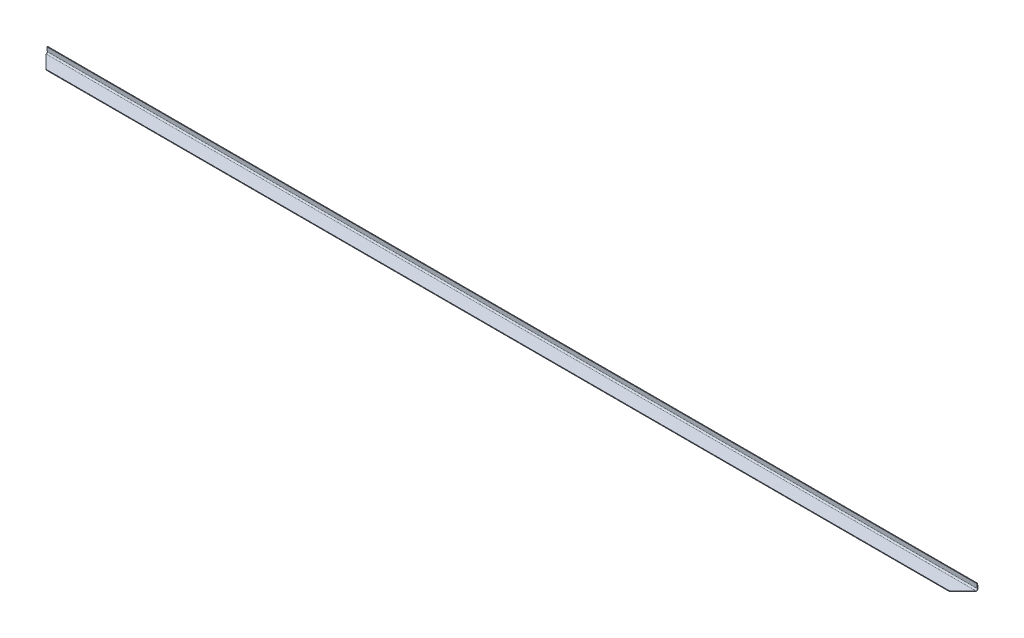
from build123d import *

# Parameters (mm, degrees)
EXTRUDE_1_DEPTH        = 1
SM_EDGE_FLANGE_1_DEPTH = 1410


# Sheet-metal steps are written as plain solids
with BuildPart() as part:
    # Sketch 1 → Бобышка-Вытянуть1 (new body)
    with BuildSketch(Plane(origin=(0, 0, 0), x_dir=(1, 0, 0), z_dir=(0, 1, 0))):
        Polygon((0, 0), (20, -20), (1390, -20), (1410, 0), align=None)
    extrude(amount=EXTRUDE_1_DEPTH)

    # Ребро-кромка1 section (across the edge) → Ребро-кромка1 (add)
    with BuildSketch(Plane(origin=(1410, 1, -2.182617002), x_dir=(0, -0.08715574274765482, 0.9961946980917459), z_dir=(-1, 0, 0))):
        with BuildLine():
            Line((-1, 2.182617002), (-1, 8.908691499))
            Line((-1, 8.908691499), (0, 8.908691499))
            Line((0, 8.908691499), (0, 2.182617002))
            ThreePointArc((0, 2.182617002), (0.648819585, 0.708062329), (2.174311485, 0.190227606))
            Line((2.174311485, 0.190227606), (2.261467228, -0.805967092))
            ThreePointArc((2.261467228, -0.805967092), (-0.026770623, -0.029215008), (-1, 2.182617002))
        make_face()
    extrude(amount=SM_EDGE_FLANGE_1_DEPTH)


solid = part.part
